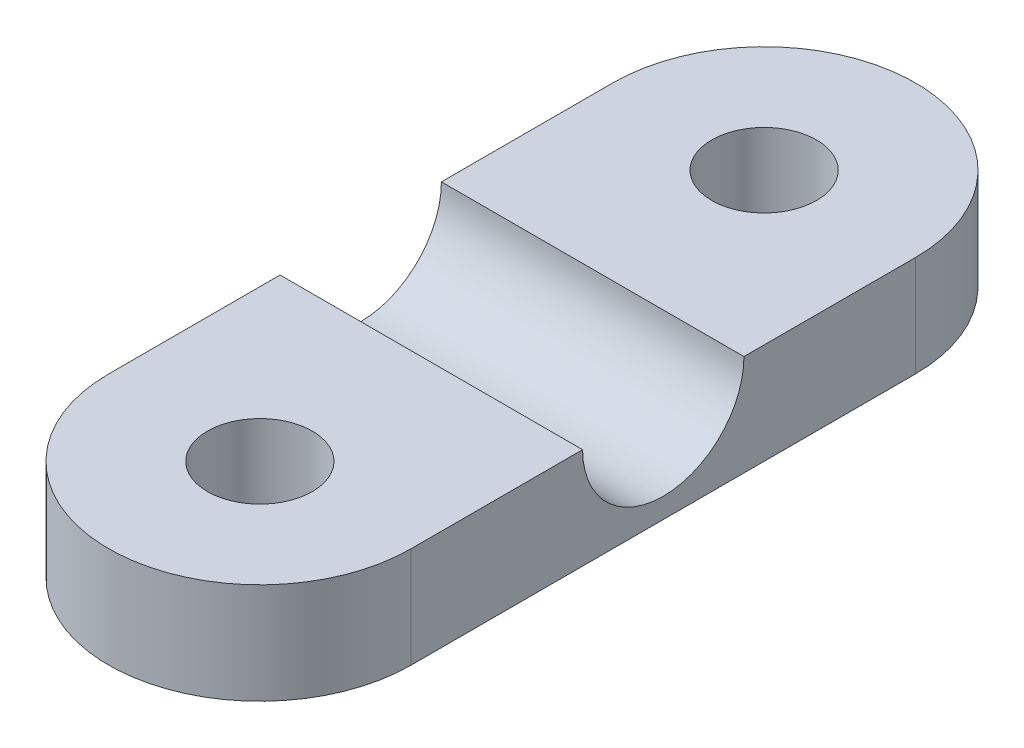
from build123d import *

# Parameters (mm, degrees)
SKETCH1_R           = 2.6
BOSS_EXTRUDE1_DEPTH = 5
CUT_EXTRUDE1_REACH  = 27.495
SKETCH2_R           = 4


with BuildPart() as part:
    # Sketch1 → Boss-Extrude1 (new body)
    with BuildSketch(Plane(origin=(0, 0, 0), x_dir=(1, 0, 0), z_dir=(0, 1, 0))):
        with BuildLine():
            ThreePointArc((7.5, 12.5), (0, 20), (-7.5, 12.5))
            Line((-7.5, 12.5), (-7.5, -12.499999986))
            ThreePointArc((-7.5, -12.499999986), (-7e-09, -20), (7.5, -12.5))
            Line((7.5, -12.5), (7.5, 12.5))
        make_face()
        with Locations((0, 12.5)):
            Circle(SKETCH1_R, mode=Mode.SUBTRACT)
        with Locations((0, -12.5)):
            Circle(SKETCH1_R, mode=Mode.SUBTRACT)
    extrude(amount=BOSS_EXTRUDE1_DEPTH)

    # Sketch2 → Cut-Extrude1 (cut, up to next)
    with BuildSketch(Plane(origin=(7.5, 0, 0), x_dir=(0, 0, -1), z_dir=(1, 0, 0)), mode=Mode.PRIVATE) as cut_extrude1_sk1:
        with Locations((0, 5)):
            Circle(SKETCH2_R)
    cut_extrude1_tool1 = extrude(cut_extrude1_sk1.sketch, amount=-CUT_EXTRUDE1_REACH, mode=Mode.PRIVATE) & part.part
    add(cut_extrude1_tool1.solids().sort_by_distance((7.5, 5, 0))[0], mode=Mode.SUBTRACT)


solid = part.part
